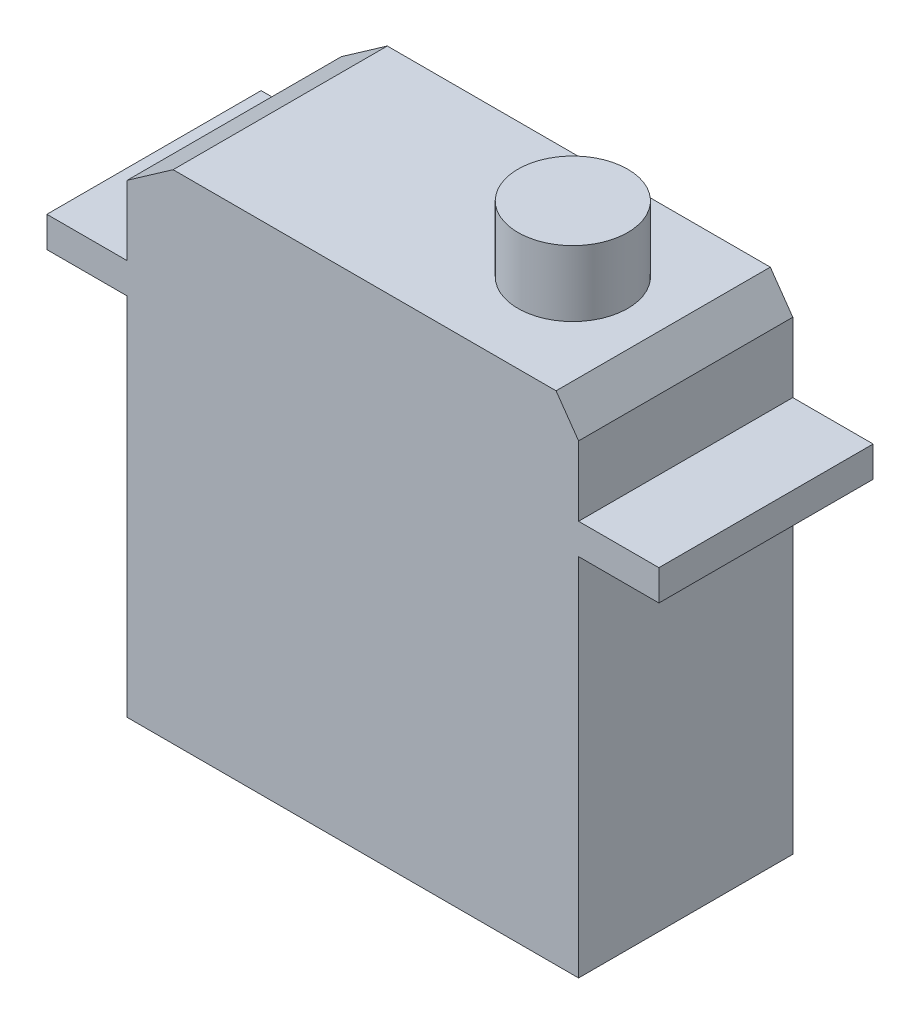
from build123d import *

# Parameters (mm, degrees)
BOSS_EXTRUDE1_DEPTH = 7
SKETCH2_R           = 3.587141307
BOSS_EXTRUDE2_DEPTH = 4.3


with BuildPart() as part:
    # Sketch1 → Boss-Extrude1 (new, symmetric)
    with BuildSketch(Plane.XY):
        Polygon((-14.75, 11.925), (-20, 11.925), (-20, 13.925), (-14.75, 13.925), (-14.75, 18.474377385), (-11.75, 20.575), (13.27912821, 20.575), (14.75, 18.474377385), (14.75, 13.925), (20, 13.925), (20, 11.925), (14.75, 11.925), (14.75, -11.925), (-14.75, -11.925), align=None)
    extrude(amount=BOSS_EXTRUDE1_DEPTH, both=True)

    # Sketch2 → Boss-Extrude2 (add)
    with BuildSketch(Plane(origin=(0, 20.575, 0), x_dir=(1, 0, 0), z_dir=(0, 1, 0))):
        with Locations((7.375, 0)):
            Circle(SKETCH2_R)
    extrude(amount=BOSS_EXTRUDE2_DEPTH)


solid = part.part
